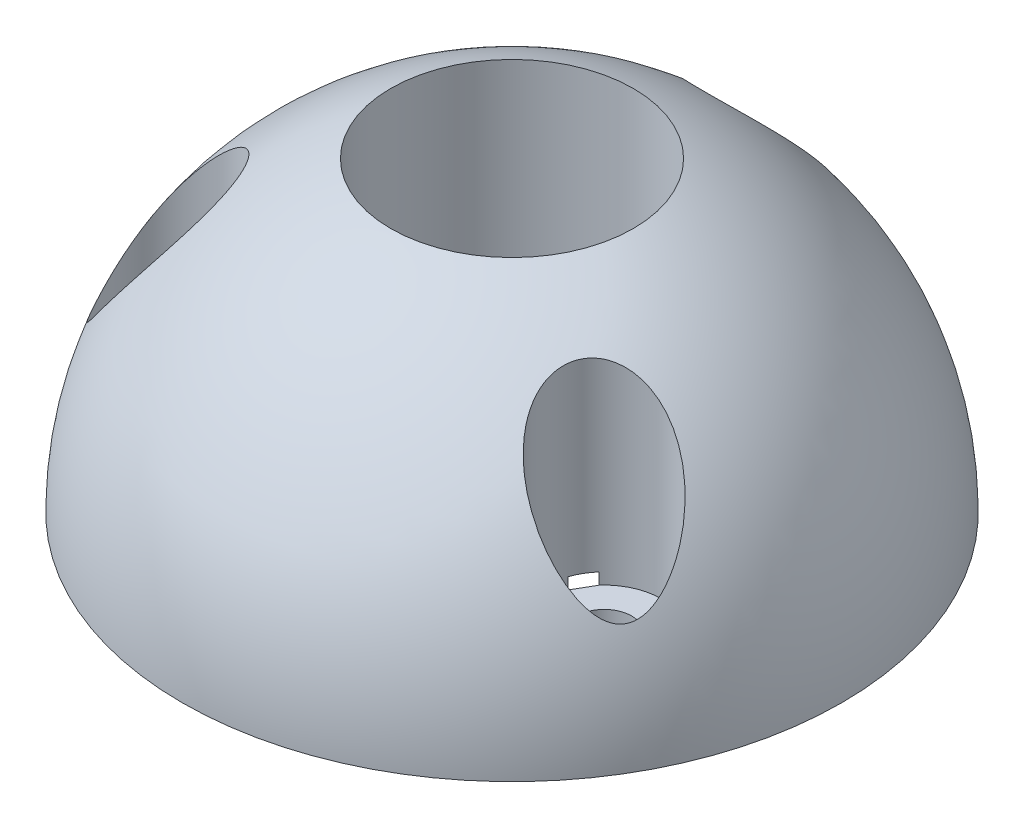
from build123d import *

# Parameters (mm, degrees)
CUT_EXTRUDE2_DEPTH = 3.5
SKETCH7_R          = 1.2
CUT_EXTRUDE6_DEPTH = 7
SKETCH3_R          = 5.3
CUT_EXTRUDE7_DEPTH = 24.098268333
CUT_EXTRUDE8_START = 3
SKETCH8_R          = 2.5
CUT_EXTRUDE8_DEPTH = 22.371910061


with BuildPart() as part:
    # Sketch1 → Revolve1 (revolve)
    with BuildSketch(Plane.XY):
        with BuildLine():
            ThreePointArc((0, 14.4), (-10.182337649, 10.182337649), (-14.4, 0))
            Line((-14.4, 0), (0, 0))
            Line((0, 0), (0, 14.4))
        make_face()
    revolve(axis=Axis((0, -1000, 0), (0, 1, 0)))

    # Sketch2 → Cut-Extrude2 (cut)
    with BuildSketch(Plane.XZ):
        Polygon((4.936344802, -8.55), (9.872689603, 0), (4.936344802, 8.55), (-4.936344802, 8.55), (-9.872689603, 0), (-4.936344802, -8.55), align=None)
    extrude(amount=-CUT_EXTRUDE2_DEPTH, mode=Mode.SUBTRACT)

    # Sketch7 → Cut-Extrude6 (cut)
    with BuildSketch(Plane.XZ):
        with Locations((-9.526279442, 5.5)):
            Circle(SKETCH7_R)
        with Locations((9.526279442, 5.5)):
            Circle(SKETCH7_R)
        with Locations((0, -11)):
            Circle(SKETCH7_R)
    extrude(amount=-CUT_EXTRUDE6_DEPTH, mode=Mode.SUBTRACT)

    # Sketch3 → Cut-Extrude7 (cut, through all)
    with BuildSketch(Plane.XZ.offset(-3.5)):
        Circle(SKETCH3_R)
    extrude(amount=-CUT_EXTRUDE7_DEPTH, mode=Mode.SUBTRACT)

    # Sketch8 → Cut-Extrude8 (cut, through all)
    with BuildSketch(Plane(origin=(0, 0, 0), x_dir=(1, 0, 0), z_dir=(0, 1, 0)).offset(CUT_EXTRUDE8_START)):
        with Locations((-9.526279442, -5.5)):
            Circle(SKETCH8_R)
        with Locations((0, 11)):
            Circle(SKETCH8_R)
        with Locations((9.526279442, -5.5)):
            Circle(SKETCH8_R)
    extrude(amount=CUT_EXTRUDE8_DEPTH, mode=Mode.SUBTRACT)


solid = part.part
